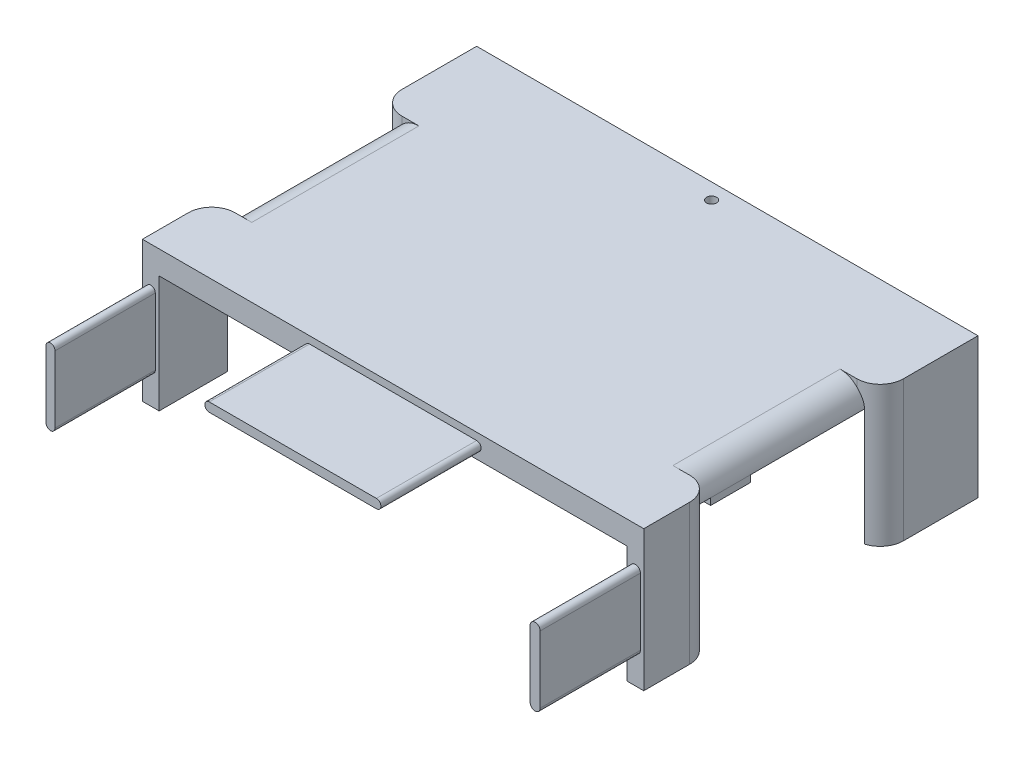
from build123d import *

# Parameters (mm, degrees)
BOSS_EXTRUDE2_DEPTH = 100
BOSS_EXTRUDE3_DEPTH = 30
SKETCH10_R          = 7.5
CUT_EXTRUDE2_DEPTH  = 210
SKETCH15_R          = 1.5
CUT_EXTRUDE3_DEPTH  = 10
SKETCH16_W          = 20
SKETCH16_H          = 12
BOSS_EXTRUDE5_DEPTH = 2
SKETCH17_W          = 3
SKETCH17_H          = 12
BOSS_EXTRUDE6_DEPTH = 25
SKETCH19_R          = 3.5
CUT_EXTRUDE4_DEPTH  = 1
SKETCH20_R          = 1.55
CUT_EXTRUDE5_DEPTH  = 3
SKETCH21_W          = 45
SKETCH21_H          = 1.5
BOSS_EXTRUDE7_DEPTH = 35
SKETCH23_R          = 8.25
CUT_EXTRUDE6_DEPTH  = 40
CUT_EXTRUDE7_DEPTH  = 40
SKETCH26_W          = 50
SKETCH26_H          = 42
CUT_EXTRUDE8_DEPTH  = 5
FILLET1_R           = 7
FILLET3_R           = 7
FILLET4_R           = 7
SKETCH27_W          = 50.001655339
SKETCH27_H          = 42
CUT_EXTRUDE9_DEPTH  = 5
FILLET5_R           = 7
FILLET6_R           = 7
FILLET7_R           = 7


# Some blends are built 0.0001 mm under size
with BuildPart() as part:
    # Sketch3 → Boss-Extrude2 (new body)
    with BuildSketch(Plane.XY):
        Polygon((-106.54853621, -30.277349769), (-106.54853621, 11.722650231), (43.45146379, 11.722650231), (43.45146379, -30.277349769), (38.45146379, -30.277349769), (38.45146379, 4.722650231), (-101.54853621, 4.722650231), (-101.54853621, -30.277349769), align=None)
    extrude(amount=BOSS_EXTRUDE2_DEPTH)

    # Sketch4 → Boss-Extrude3 (add)
    with BuildSketch(Plane.XY.offset(100)):
        with BuildLine():
            Line((-102.69853621, -0.277349769), (-102.69853621, -20.277349769))
            ThreePointArc((-102.69853621, -20.277349769), (-104.04853621, -21.627349769), (-105.39853621, -20.277349769))
            Line((-105.39853621, -20.277349769), (-105.39853621, -0.277349769))
            ThreePointArc((-105.39853621, -0.277349769), (-104.04853621, 1.072650231), (-102.69853621, -0.277349769))
        make_face()
        with BuildLine():
            Line((-56.54853621, 9.572650231), (-6.54853621, 9.572650231))
            ThreePointArc((-6.54853621, 9.572650231), (-5.19853621, 8.222650231), (-6.54853621, 6.872650231))
            Line((-6.54853621, 6.872650231), (-56.54853621, 6.872650231))
            ThreePointArc((-56.54853621, 6.872650231), (-57.89853621, 8.222650231), (-56.54853621, 9.572650231))
        make_face()
        with BuildLine():
            Line((42.45146379, -0.277349769), (42.45146379, -20.277349769))
            ThreePointArc((42.45146379, -20.277349769), (40.95146379, -21.777349769), (39.45146379, -20.277349769))
            Line((39.45146379, -20.277349769), (39.45146379, -0.277349769))
            ThreePointArc((39.45146379, -0.277349769), (40.95146379, 1.222650231), (42.45146379, -0.277349769))
        make_face()
    extrude(amount=BOSS_EXTRUDE3_DEPTH)

    # Sketch10 → Cut-Extrude2 (cut)
    with BuildSketch(Plane(origin=(43.45146379, 0, 0), x_dir=(0, 0, -1), z_dir=(1, 0, 0))):
        with Locations((-45, -8.277349769)):
            Circle(SKETCH10_R)
    extrude(amount=-CUT_EXTRUDE2_DEPTH, mode=Mode.SUBTRACT)

    # Sketch15 → Cut-Extrude3 (cut)
    with BuildSketch(Plane(origin=(0, 11.722650231, 0), x_dir=(1, 0, 0), z_dir=(0, 1, 0))):
        with Locations(Location((-31.54853621, -4.714245873, 0), (0, 0, 270))):
            Circle(SKETCH15_R)
    extrude(amount=-CUT_EXTRUDE3_DEPTH, mode=Mode.SUBTRACT)

    # Sketch16 → Boss-Extrude5 (add)
    with BuildSketch(Plane.XZ.offset(-4.722650231)):
        with Locations((28.45146379, 69)):
            Rectangle(SKETCH16_W, SKETCH16_H)
    boss_extrude5 = extrude(amount=BOSS_EXTRUDE5_DEPTH)

    # Sketch17 → Boss-Extrude6 (add)
    with BuildSketch(Plane(origin=(0, 2.722650231, 0), x_dir=(-1, 0, 0), z_dir=(0, -1, 0))):
        with Locations((-19.95146379, -69)):
            Rectangle(SKETCH17_W, SKETCH17_H)
    boss_extrude6 = extrude(amount=BOSS_EXTRUDE6_DEPTH)

    # Sketch19 → Cut-Extrude4 (cut)
    with BuildSketch(Plane.ZY.offset(-18.45146379)):
        with Locations((69.485133357, 0.222650231)):
            Circle(SKETCH19_R)
        with Locations((69.485133357, -17.777349769)):
            Circle(SKETCH19_R)
    cut_extrude4 = extrude(amount=-CUT_EXTRUDE4_DEPTH, mode=Mode.SUBTRACT)

    # Sketch20 → Cut-Extrude5 (cut)
    with BuildSketch(Plane.ZY.offset(-19.45146379)):
        with Locations((69.485133357, 0.222650231)):
            Circle(SKETCH20_R)
        with Locations((69.485133357, -17.777349769)):
            Circle(SKETCH20_R)
    cut_extrude5 = extrude(amount=-CUT_EXTRUDE5_DEPTH, mode=Mode.SUBTRACT)

    # Mirror6: Boss-Extrude5, Boss-Extrude6, Cut-Extrude4, Cut-Extrude5 across plane
    add(boss_extrude5.mirror(Plane.ZY.offset(31.54853621)))
    add(boss_extrude6.mirror(Plane.ZY.offset(31.54853621)))
    add(cut_extrude4.mirror(Plane.ZY.offset(31.54853621)), mode=Mode.SUBTRACT)
    add(cut_extrude5.mirror(Plane.ZY.offset(31.54853621)), mode=Mode.SUBTRACT)

    # Sketch21 → Boss-Extrude7 (add)
    with BuildSketch(Plane.XZ.offset(-4.722650231)):
        with Locations((-31.54853621, 0.75)):
            Rectangle(SKETCH21_W, SKETCH21_H)
    extrude(amount=BOSS_EXTRUDE7_DEPTH)

    # Sketch23 → Cut-Extrude6 (cut)
    with BuildSketch(Plane(origin=(0, 0, 0), x_dir=(-1, 0, 0), z_dir=(0, 0, -1))):
        with Locations((44.54853621, -16.277349769)):
            Circle(SKETCH23_R)
        with Locations((18.54853621, -16.277349769)):
            Circle(SKETCH23_R)
    extrude(amount=-CUT_EXTRUDE6_DEPTH, mode=Mode.SUBTRACT)

    # Sketch24 → Cut-Extrude7 (cut)
    with BuildSketch(Plane(origin=(0, 0, 0), x_dir=(-1, 0, 0), z_dir=(0, 0, -1))):
        with BuildLine():
            Line((26.54853621, -23.095326639), (36.54853621, -23.095326639))
            ThreePointArc((36.54853621, -23.095326639), (39.773941895, -26.320732325), (36.54853621, -29.54613801))
            Line((36.54853621, -29.54613801), (26.54853621, -29.54613801))
            ThreePointArc((26.54853621, -29.54613801), (23.323130524, -26.320732325), (26.54853621, -23.095326639))
        make_face()
    extrude(amount=-CUT_EXTRUDE7_DEPTH, mode=Mode.SUBTRACT)

    # Sketch26 → Cut-Extrude8 (cut)
    with BuildSketch(Plane.ZY.offset(106.54853621)):
        with Locations((54.271655339, -9.277349769)):
            Rectangle(SKETCH26_W, SKETCH26_H)
    extrude(amount=-CUT_EXTRUDE8_DEPTH, mode=Mode.SUBTRACT)

    # Fillet1
    fillet1_edges = [part.edges().sort_by_distance(p)[0] for p in [
        (-101.54853621, 11.722650231, 54.271655339),
    ]]
    fillet(fillet1_edges, radius=FILLET1_R - 0.0001)  # a hair under: the kernel refuses the full size

    # Fillet3
    # the kernel refuses this fillet: 7 mm, written as the material it takes off along each edge
    with BuildSketch(Plane(origin=(-106.54853621, -47.777349769, 29.271655339), x_dir=(0, 0, -1), z_dir=(0, 1, 0))) as fillet3_piece_1_section:
        with BuildLine():
            CenterArc((FILLET3_R, -FILLET3_R), FILLET3_R, 90, 90)
            Line((0, -FILLET3_R), (0, 0))
            Line((0, 0), (FILLET3_R, 0))
        make_face()
    fillet3_piece_1 = extrude(amount=77, mode=Mode.PRIVATE)
    fillet3_piece_1 = fillet3_piece_1 - Plane(origin=(-94.54863621, 4.722750231, 27.624323614), x_dir=(0, 1, 0), z_dir=(0, 0, 1)) * Cylinder(6.9999, 182, mode=Mode.PRIVATE)
    add(fillet3_piece_1, mode=Mode.SUBTRACT)

    # Fillet4
    # the kernel refuses this fillet: 7 mm, written as the material it takes off along each edge
    with BuildSketch(Plane(origin=(-106.54853621, 29.222650231, 79.271655339), x_dir=(0, 0, 1), z_dir=(0, -1, 0))) as fillet4_piece_1_section:
        with BuildLine():
            CenterArc((FILLET4_R, -FILLET4_R), FILLET4_R, 90, 90)
            Line((0, -FILLET4_R), (0, 0))
            Line((0, 0), (FILLET4_R, 0))
        make_face()
    fillet4_piece_1 = extrude(amount=77, mode=Mode.PRIVATE)
    fillet4_piece_1 = fillet4_piece_1 - Plane(origin=(-94.54863621, 4.722750231, 80.918987064), x_dir=(0, 1, 0), z_dir=(0, 0, 1)) * Cylinder(6.9999, 182, mode=Mode.PRIVATE)
    add(fillet4_piece_1, mode=Mode.SUBTRACT)

    # Sketch27 → Cut-Extrude9 (cut)
    with BuildSketch(Plane(origin=(43.45146379, 0, 0), x_dir=(0, 0, -1), z_dir=(1, 0, 0))):
        with Locations((-54.27082767, -9.277349769)):
            Rectangle(SKETCH27_W, SKETCH27_H)
    extrude(amount=-CUT_EXTRUDE9_DEPTH, mode=Mode.SUBTRACT)

    # Fillet5
    fillet5_edges = [part.edges().sort_by_distance(p)[0] for p in [
        (38.45146379, 11.722650231, 54.270827669),
    ]]
    fillet(fillet5_edges, radius=FILLET5_R - 0.0001)  # a hair under: the kernel refuses the full size

    # Fillet6
    # the kernel refuses this fillet: 7 mm, written as the material it takes off along each edge
    with BuildSketch(Plane(origin=(43.45146379, -47.777349769, 29.27), x_dir=(0, 0, -1), z_dir=(0, 1, 0))) as fillet6_piece_1_section:
        with BuildLine():
            CenterArc((FILLET6_R, FILLET6_R), FILLET6_R, 180, 90)
            Line((0, FILLET6_R), (0, 0))
            Line((0, 0), (FILLET6_R, 0))
        make_face()
    fillet6_piece_1 = extrude(amount=77, mode=Mode.PRIVATE)
    fillet6_piece_1 = fillet6_piece_1 - Plane(origin=(31.45156379, 4.722750231, 27.622668275), x_dir=(0, 1, 0), z_dir=(0, 0, 1)) * Cylinder(6.9999, 182, mode=Mode.PRIVATE)
    add(fillet6_piece_1, mode=Mode.SUBTRACT)

    # Fillet7
    # the kernel refuses this fillet: 7 mm, written as the material it takes off along each edge
    with BuildSketch(Plane(origin=(43.45146379, 29.222650231, 79.271655339), x_dir=(-1, 0, 0), z_dir=(0, -1, 0))) as fillet7_piece_1_section:
        with BuildLine():
            CenterArc((FILLET7_R, -FILLET7_R), FILLET7_R, 90, 90)
            Line((0, -FILLET7_R), (0, 0))
            Line((0, 0), (FILLET7_R, 0))
        make_face()
    fillet7_piece_1 = extrude(amount=77, mode=Mode.PRIVATE)
    fillet7_piece_1 = fillet7_piece_1 - Plane(origin=(31.45156379, 4.722750231, 79.268302474), x_dir=(0, 1, 0), z_dir=(0, 0, 1)) * Cylinder(6.9999, 183, mode=Mode.PRIVATE)
    add(fillet7_piece_1, mode=Mode.SUBTRACT)


solid = part.part
